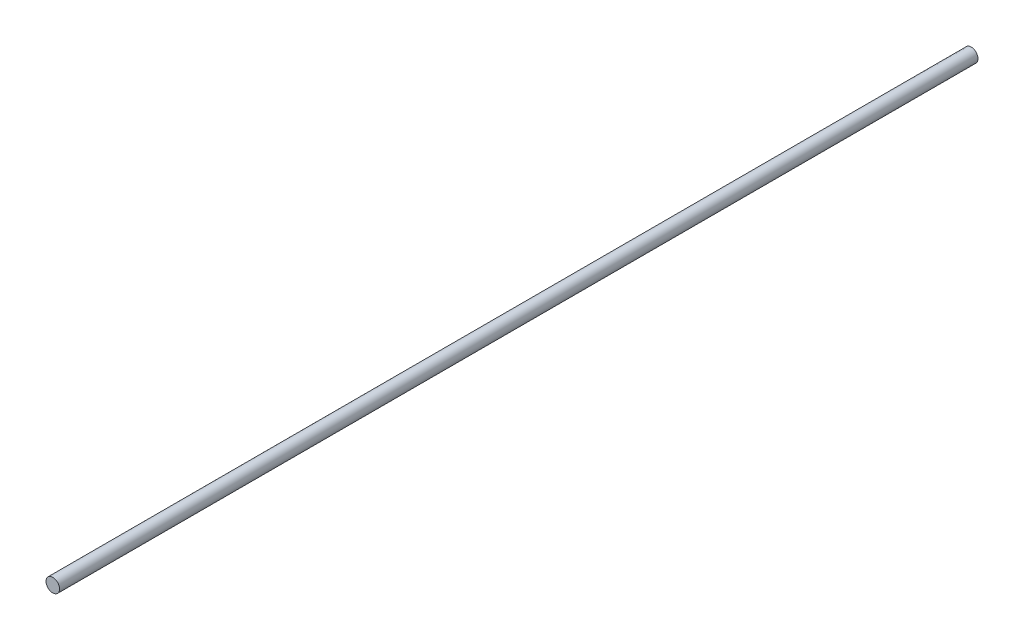
from build123d import *

# Parameters (mm, degrees)
SKETCH1_R           = 4
BOSS_EXTRUDE1_DEPTH = 271


with BuildPart() as part:
    # Sketch1 → Boss-Extrude1 (new, symmetric)
    with BuildSketch(Plane.XY):
        Circle(SKETCH1_R)
    extrude(amount=BOSS_EXTRUDE1_DEPTH, both=True)


solid = part.part
